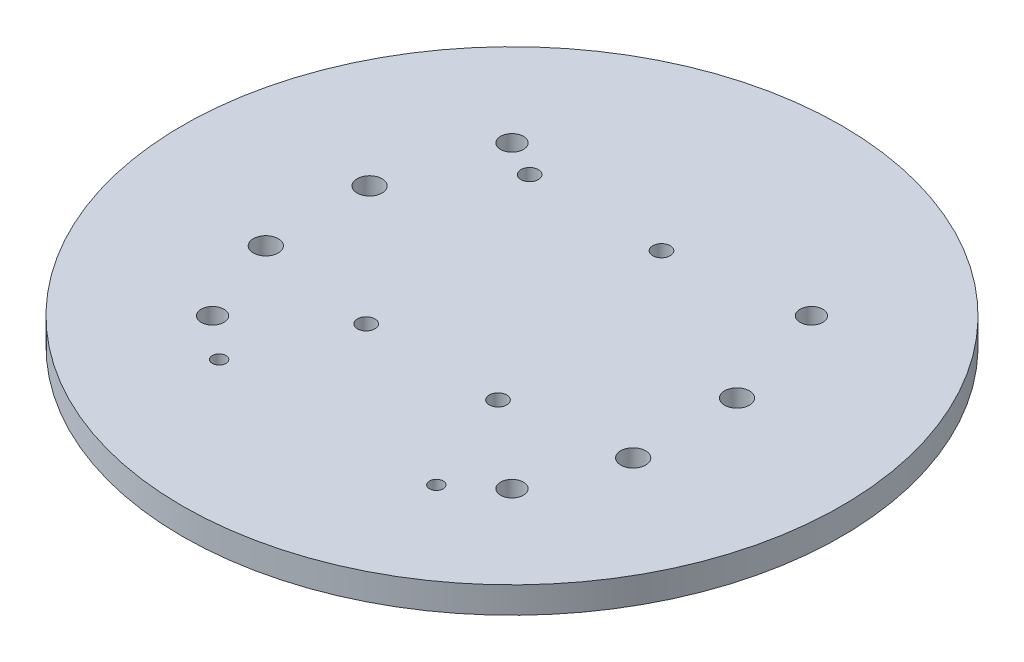
from build123d import *

# Parameters (mm, degrees)
SKETCH1_R                   = 79.375
BOSS_EXTRUDE1_DEPTH         = 3.175
TAP_DRILL_FOR_M5X0_8_TAP1_D = 4.2
TAP_DRILL_FOR_M7X1_0_TAP1_D = 6
TAP_DRILL_FOR_M4X0_7_TAP1_D = 3.3
M5_CLEARANCE_HOLE1_D        = 5.5


with BuildPart() as part:
    # Sketch1 → Boss-Extrude1 (new, symmetric)
    with BuildSketch(Plane(origin=(0, 0, 0), x_dir=(1, 0, 0), z_dir=(0, 1, 0))):
        Circle(SKETCH1_R)
    extrude(amount=BOSS_EXTRUDE1_DEPTH, both=True)

    # Tap Drill for M5x0.8 Tap1 (through all)
    with Locations(Plane(origin=(0, 3.175, 0), x_dir=(1, 0, 0), z_dir=(0, 1, 0))):
        with Locations((-27.3188086, 31.571183672), (4.4311914, 31.571183672), (-15.875, -19.245910728), (15.875, -19.245910728)):
            Hole(TAP_DRILL_FOR_M5X0_8_TAP1_D / 2)

    # Tap Drill for M7x1.0 Tap1 (through all)
    with Locations(Plane(origin=(0, 3.175, 0), x_dir=(1, 0, 0), z_dir=(0, 1, 0))):
        with Locations((-44.245, 9.941583672), (-44.245, -15.058416328), (44.245, 9.941583672), (44.245, -15.058416328)):
            Hole(TAP_DRILL_FOR_M7X1_0_TAP1_D / 2)

    # Tap Drill for M4x0.7 Tap1 (through all)
    with Locations(Plane(origin=(0, 3.175, 0), x_dir=(1, 0, 0), z_dir=(0, 1, 0))):
        with Locations((-26.155, -44.384416328), (26.155, -44.384416328)):
            Hole(TAP_DRILL_FOR_M4X0_7_TAP1_D / 2)

    # M5 Clearance Hole1 (through all)
    with Locations(Plane(origin=(0, 3.175, 0), x_dir=(1, 0, 0), z_dir=(0, 1, 0))):
        with Locations((-36.062445841, 36.062445841), (-36.062445841, -36.062445841), (36.062445841, -36.062445841), (36.062445841, 36.062445841)):
            Hole(M5_CLEARANCE_HOLE1_D / 2)


solid = part.part
